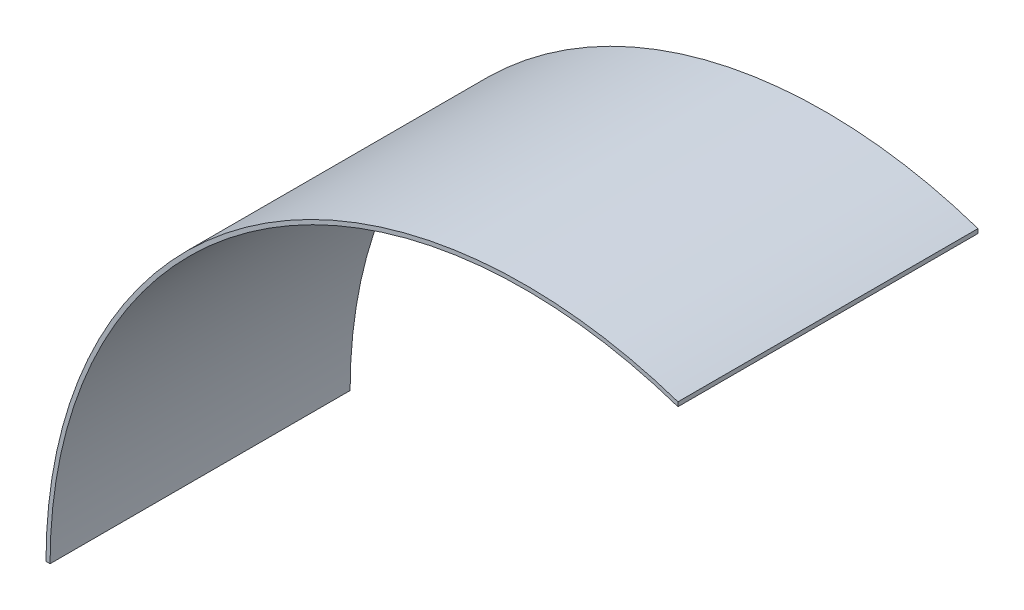
from build123d import *

# Parameters (mm, degrees)
INNER_RING_LEFT_SIDE_DEPTH = 112.268


with BuildPart() as part:
    # Sketch1 → Inner Ring - Left Side (new body)
    with BuildSketch(Plane.XY):
        with BuildLine():
            Line((57.15, 169.9680928), (57.15, 168.364834511))
            ThreePointArc((57.15, 168.364834511), (-103.565365832, 144.523544795), (-177.8, 0))
            Line((-177.8, 0), (-179.31892, 0))
            ThreePointArc((-179.31892, 0), (-104.659444848, 145.60795196), (57.15, 169.9680928))
        make_face()
    extrude(amount=INNER_RING_LEFT_SIDE_DEPTH)


solid = part.part
